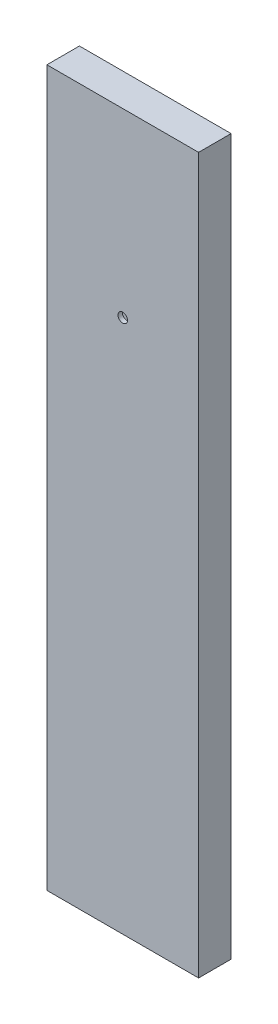
from build123d import *

# Parameters (mm, degrees)
SKETCH1_W           = 88.9
SKETCH1_H           = 19.05
BOSS_EXTRUDE1_DEPTH = 419.1
SKETCH2_R           = 2.778125
CUT_EXTRUDE1_DEPTH  = 2.54


with BuildPart() as part:
    # Sketch1 → Boss-Extrude1 (new body)
    with BuildSketch(Plane(origin=(0, 0, 0), x_dir=(1, 0, 0), z_dir=(0, 1, 0))):
        with Locations((44.45, 9.525)):
            Rectangle(SKETCH1_W, SKETCH1_H)
    extrude(amount=BOSS_EXTRUDE1_DEPTH)

    # Sketch2 → Cut-Extrude1 (cut)
    with BuildSketch(Plane.XY):
        with Locations((-349.25, 406.4)):
            Circle(SKETCH2_R)
        with Locations((44.45, 312.970422028)):
            Circle(SKETCH2_R)
    extrude(amount=-CUT_EXTRUDE1_DEPTH, mode=Mode.SUBTRACT)


solid = part.part
